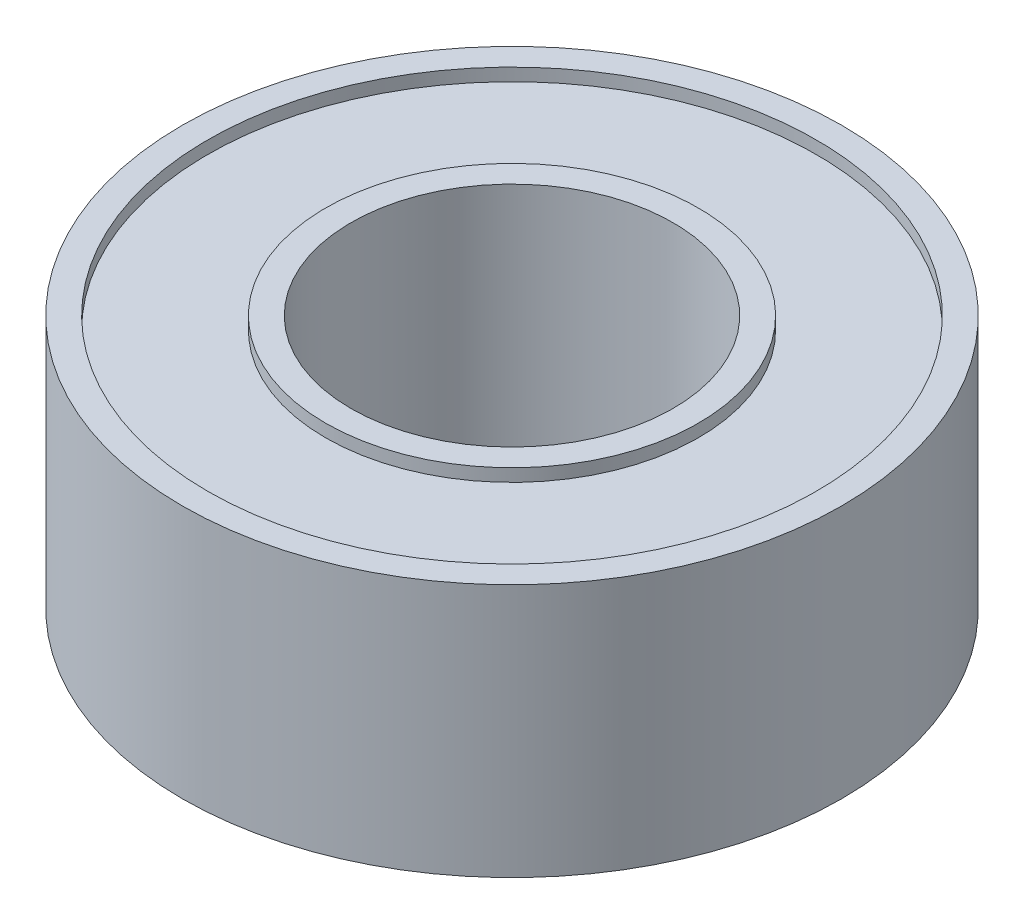
from build123d import *

# Parameters (mm, degrees)
SKETCH1_R           = 6.5
SKETCH1_R_2         = 3.175
BOSS_EXTRUDE1_DEPTH = 5
SKETCH2_W           = 2.325
SKETCH2_H           = 0.25


with BuildPart() as part:
    # Sketch1 → Boss-Extrude1 (new body)
    with BuildSketch(Plane(origin=(0, 0, 0), x_dir=(1, 0, 0), z_dir=(0, 1, 0))):
        Circle(SKETCH1_R)
        Circle(SKETCH1_R_2, mode=Mode.SUBTRACT)
    extrude(amount=BOSS_EXTRUDE1_DEPTH)

    # Sketch2 → Cut-Revolve1 (revolve, cut)
    with BuildSketch(Plane.XY):
        with Locations((-4.8375, 4.875)):
            Rectangle(SKETCH2_W, SKETCH2_H)
        with Locations((-4.8375, 0.125)):
            Rectangle(SKETCH2_W, SKETCH2_H)
    revolve(axis=Axis((0, 5, 0), (0, -1, 0)), mode=Mode.SUBTRACT)


solid = part.part
